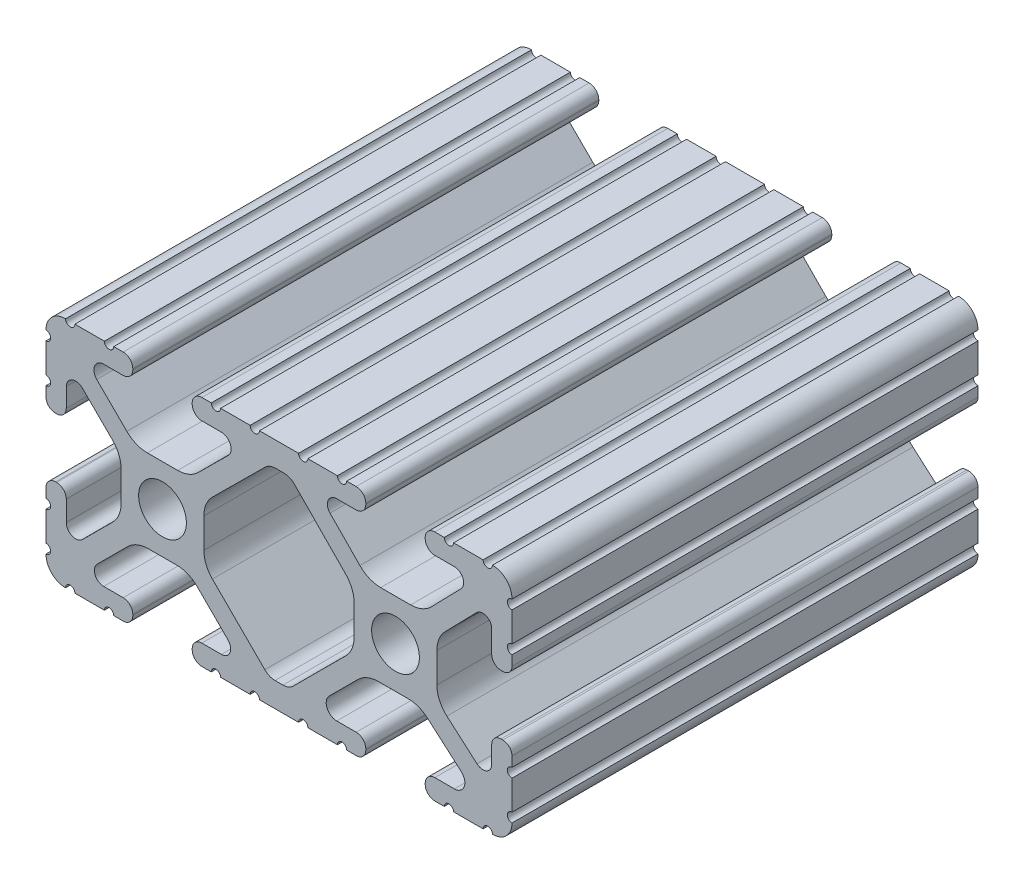
from build123d import *

# Parameters (mm, degrees)
SKETCH1_R      = 2.6035
EXTRUDE1_DEPTH = 50.8


with BuildPart() as part:
    # Sketch1 → Extrude1 (new body)
    with BuildSketch(Plane.XY):
        with BuildLine():
            Line((22.2504, 12.7), (19.03310265, 12.7))
            ThreePointArc((19.03310265, 12.7), (18.52510265, 12.192), (18.01710265, 12.7))
            Line((18.01710265, 12.7), (16.98745015, 12.7))
            ThreePointArc((16.98745015, 12.7), (16.245730386, 12.392769614), (15.9385, 11.65104985))
            Line((15.9385, 11.65104985), (15.9385, 11.53922))
            ThreePointArc((15.9385, 11.53922), (16.245750844, 10.797450844), (16.98752, 10.4902))
            Line((16.98752, 10.4902), (19.116384363, 10.4902))
            ThreePointArc((19.116384363, 10.4902), (20.052502933, 9.869096983), (19.844087081, 8.765172272))
            Line((19.844087081, 8.765172272), (16.618993479, 5.455112286))
            ThreePointArc((16.618993479, 5.455112286), (15.578994274, 4.745442459), (14.344932584, 4.4958))
            Line((14.344932584, 4.4958), (11.083317835, 4.4958))
            ThreePointArc((11.083317835, 4.4958), (9.854330953, 4.743306833), (8.816955189, 5.447238587))
            Line((8.816955189, 5.447238587), (5.564154119, 8.762652677))
            ThreePointArc((5.564154119, 8.762652677), (5.352591412, 9.867473037), (6.289393385, 10.4902))
            Line((6.289393385, 10.4902), (8.41248, 10.4902))
            ThreePointArc((8.41248, 10.4902), (9.154249156, 10.797450844), (9.4615, 11.53922))
            Line((9.4615, 11.53922), (9.4615, 11.65104985))
            ThreePointArc((9.4615, 11.65104985), (9.154269614, 12.392769614), (8.41254985, 12.7))
            Line((8.41254985, 12.7), (7.38288465, 12.7))
            ThreePointArc((7.38288465, 12.7), (6.87488465, 12.192), (6.36688465, 12.7))
            Line((6.36688465, 12.7), (3.14958095, 12.7))
            ThreePointArc((3.14958095, 12.7), (2.64158095, 12.192), (2.13358095, 12.7))
            Line((2.13358095, 12.7), (-2.13358095, 12.7))
            ThreePointArc((-2.13358095, 12.7), (-2.64158095, 12.192), (-3.14958095, 12.7))
            Line((-3.14958095, 12.7), (-6.36689735, 12.7))
            ThreePointArc((-6.36689735, 12.7), (-6.87489735, 12.192), (-7.38289735, 12.7))
            Line((-7.38289735, 12.7), (-8.41254985, 12.7))
            ThreePointArc((-8.41254985, 12.7), (-9.154269614, 12.392769614), (-9.4615, 11.65104985))
            Line((-9.4615, 11.65104985), (-9.4615, 11.53922))
            ThreePointArc((-9.4615, 11.53922), (-9.154249156, 10.797450844), (-8.41248, 10.4902))
            Line((-8.41248, 10.4902), (-6.283641037, 10.4902))
            ThreePointArc((-6.283641037, 10.4902), (-5.297291557, 9.829633109), (-5.532576693, 8.666071843))
            Line((-5.532576693, 8.666071843), (-8.809985098, 5.416263103))
            ThreePointArc((-8.809985098, 5.416263103), (-9.836720513, 4.734920264), (-11.045536121, 4.4958))
            Line((-11.045536121, 4.4958), (-14.354463879, 4.4958))
            ThreePointArc((-14.354463879, 4.4958), (-15.563279487, 4.734920264), (-16.590014902, 5.416263103))
            Line((-16.590014902, 5.416263103), (-19.867423307, 8.666071843))
            ThreePointArc((-19.867423307, 8.666071843), (-20.102708443, 9.829633109), (-19.116358963, 10.4902))
            Line((-19.116358963, 10.4902), (-16.98752, 10.4902))
            ThreePointArc((-16.98752, 10.4902), (-16.245750844, 10.797450844), (-15.9385, 11.53922))
            Line((-15.9385, 11.53922), (-15.9385, 11.65104985))
            ThreePointArc((-15.9385, 11.65104985), (-16.245730386, 12.392769614), (-16.98745015, 12.7))
            Line((-16.98745015, 12.7), (-18.01711535, 12.7))
            ThreePointArc((-18.01711535, 12.7), (-18.52511535, 12.192), (-19.03311535, 12.7))
            Line((-19.03311535, 12.7), (-22.2504, 12.7))
            ThreePointArc((-22.2504, 12.7), (-22.758323491, 12.192000006), (-23.266399977, 12.699846982))
            ThreePointArc((-23.266399977, 12.699846982), (-24.782522516, 12.082522516), (-25.399846982, 10.566399977))
            ThreePointArc((-25.399846982, 10.566399977), (-24.892000006, 10.058323491), (-25.4, 9.5504))
            Line((-25.4, 9.5504), (-25.4, 6.3330836))
            ThreePointArc((-25.4, 6.3330836), (-24.892, 5.8250836), (-25.4, 5.3170836))
            Line((-25.4, 5.3170836), (-25.4, 4.237520184))
            ThreePointArc((-25.4, 4.237520184), (-25.107393763, 3.531106237), (-24.400979816, 3.2385))
            Line((-24.400979816, 3.2385), (-24.23922, 3.2385))
            ThreePointArc((-24.23922, 3.2385), (-23.497450844, 3.545750844), (-23.1902, 4.28752))
            Line((-23.1902, 4.28752), (-23.1902, 6.334741132))
            ThreePointArc((-23.1902, 6.334741132), (-22.556026952, 7.286023527), (-21.434002553, 7.066535717))
            Line((-21.434002553, 7.066535717), (-18.147950853, 3.808156468))
            ThreePointArc((-18.147950853, 3.808156468), (-17.452759693, 2.774838327), (-17.208501877, 1.553619571))
            Line((-17.208501877, 1.553619571), (-17.208501877, -1.695179196))
            ThreePointArc((-17.208501877, -1.695179196), (-17.450738657, -2.911536421), (-18.140486065, -3.942289578))
            Line((-18.140486065, -3.942289578), (-21.431579576, -7.227386226))
            ThreePointArc((-21.431579576, -7.227386226), (-22.55444896, -7.449940594), (-23.1902, -6.498002195))
            Line((-23.1902, -6.498002195), (-23.1902, -4.28752))
            ThreePointArc((-23.1902, -4.28752), (-23.497450844, -3.545750844), (-24.23922, -3.2385))
            Line((-24.23922, -3.2385), (-24.35098, -3.2385))
            ThreePointArc((-24.35098, -3.2385), (-25.092749156, -3.545750844), (-25.4, -4.28752))
            Line((-25.4, -4.28752), (-25.4, -5.3171344))
            ThreePointArc((-25.4, -5.3171344), (-24.892, -5.8251344), (-25.4, -6.3331344))
            Line((-25.4, -6.3331344), (-25.4, -9.5504))
            ThreePointArc((-25.4, -9.5504), (-24.892000006, -10.058323491), (-25.399846982, -10.566399977))
            ThreePointArc((-25.399846982, -10.566399977), (-24.782522516, -12.082522516), (-23.266399977, -12.699846982))
            ThreePointArc((-23.266399977, -12.699846982), (-22.758323491, -12.192000006), (-22.2504, -12.7))
            Line((-22.2504, -12.7), (-19.03308995, -12.7))
            ThreePointArc((-19.03308995, -12.7), (-18.52508995, -12.192), (-18.01708995, -12.7))
            Line((-18.01708995, -12.7), (-16.9874692, -12.7))
            ThreePointArc((-16.9874692, -12.7), (-16.245700044, -12.392749156), (-15.9384492, -11.65098))
            Line((-15.9384492, -11.65098), (-15.9384492, -11.53922))
            ThreePointArc((-15.9384492, -11.53922), (-16.245700044, -10.797450844), (-16.9874692, -10.4902))
            Line((-16.9874692, -10.4902), (-19.116358963, -10.4902))
            ThreePointArc((-19.116358963, -10.4902), (-20.055197748, -9.862578342), (-19.834124023, -8.755124678))
            Line((-19.834124023, -8.755124678), (-16.49660751, -5.423689618))
            ThreePointArc((-16.49660751, -5.423689618), (-15.467274017, -4.736928798), (-14.253591699, -4.4958))
            Line((-14.253591699, -4.4958), (-11.146408301, -4.4958))
            ThreePointArc((-11.146408301, -4.4958), (-9.932725983, -4.736928798), (-8.90339249, -5.423689618))
            Line((-8.90339249, -5.423689618), (-5.565875977, -8.755124678))
            ThreePointArc((-5.565875977, -8.755124678), (-5.344802252, -9.862578342), (-6.283641037, -10.4902))
            Line((-6.283641037, -10.4902), (-8.4125308, -10.4902))
            ThreePointArc((-8.4125308, -10.4902), (-9.154299956, -10.797450844), (-9.4615508, -11.53922))
            Line((-9.4615508, -11.53922), (-9.4615508, -11.65098))
            ThreePointArc((-9.4615508, -11.65098), (-9.154299956, -12.392749156), (-8.4125308, -12.7))
            Line((-8.4125308, -12.7), (-7.38287195, -12.7))
            ThreePointArc((-7.38287195, -12.7), (-6.87487195, -12.192), (-6.36687195, -12.7))
            Line((-6.36687195, -12.7), (-3.14960635, -12.7))
            ThreePointArc((-3.14960635, -12.7), (-2.64160635, -12.192), (-2.13360635, -12.7))
            Line((-2.13360635, -12.7), (2.13360635, -12.7))
            ThreePointArc((2.13360635, -12.7), (2.64159365, -12.1920127), (3.14958095, -12.7))
            Line((3.14958095, -12.7), (6.36691005, -12.7))
            ThreePointArc((6.36691005, -12.7), (6.87491005, -12.192), (7.38291005, -12.7))
            Line((7.38291005, -12.7), (8.4125308, -12.7))
            ThreePointArc((8.4125308, -12.7), (9.154299956, -12.392749156), (9.4615508, -11.65098))
            Line((9.4615508, -11.65098), (9.4615508, -11.53922))
            ThreePointArc((9.4615508, -11.53922), (9.154299956, -10.797450844), (8.4125308, -10.4902))
            Line((8.4125308, -10.4902), (6.289393385, -10.4902))
            ThreePointArc((6.289393385, -10.4902), (5.231590322, -9.783049717), (5.480677245, -8.535265862))
            Line((5.480677245, -8.535265862), (8.597933595, -5.423689618))
            ThreePointArc((8.597933595, -5.423689618), (9.627267088, -4.736928798), (10.840949406, -4.4958))
            Line((10.840949406, -4.4958), (14.102564155, -4.4958))
            ThreePointArc((14.102564155, -4.4958), (15.215927525, -4.697410182), (16.187895372, -5.276636531))
            Line((16.187895372, -5.276636531), (19.868247549, -8.482246082))
            ThreePointArc((19.868247549, -8.482246082), (20.188435806, -9.746879864), (19.116384363, -10.4902))
            Line((19.116384363, -10.4902), (16.9874692, -10.4902))
            ThreePointArc((16.9874692, -10.4902), (16.245700044, -10.797450844), (15.9384492, -11.53922))
            Line((15.9384492, -11.53922), (15.9384492, -11.65098))
            ThreePointArc((15.9384492, -11.65098), (16.245700044, -12.392749156), (16.9874692, -12.7))
            Line((16.9874692, -12.7), (18.01710265, -12.7))
            ThreePointArc((18.01710265, -12.7), (18.52510265, -12.192), (19.03310265, -12.7))
            Line((19.03310265, -12.7), (22.2504, -12.7))
            ThreePointArc((22.2504, -12.7), (22.758323491, -12.192000006), (23.266399977, -12.699846982))
            ThreePointArc((23.266399977, -12.699846982), (24.782522516, -12.082522516), (25.399846982, -10.566399977))
            ThreePointArc((25.399846982, -10.566399977), (24.892000006, -10.058323492), (25.4, -9.550400001))
            Line((25.4, -9.550400001), (25.4, -6.333083592))
            ThreePointArc((25.4, -6.333083592), (24.892000001, -5.825083593), (25.4, -5.317083593))
            Line((25.4, -5.317083593), (25.4, -4.237520184))
            ThreePointArc((25.4, -4.237520184), (25.107393763, -3.531106237), (24.400979816, -3.2385))
            Line((24.400979816, -3.2385), (24.189220184, -3.2385))
            ThreePointArc((24.189220184, -3.2385), (23.482806237, -3.531106237), (23.1902, -4.237520184))
            Line((23.1902, -4.237520184), (23.1902, -6.155876159))
            ThreePointArc((23.1902, -6.155876159), (22.62232736, -7.038258539), (21.583974541, -6.886926384))
            Line((21.583974541, -6.886926384), (18.29817066, -4.024970844))
            ThreePointArc((18.29817066, -4.024970844), (17.493730985, -2.946044689), (17.208501877, -1.630807374))
            Line((17.208501877, -1.630807374), (17.208501877, 1.630807374))
            ThreePointArc((17.208501877, 1.630807374), (17.442348332, 2.82673414), (18.109440981, 3.846495088))
            Line((18.109440981, 3.846495088), (21.526346532, 7.353420386))
            ThreePointArc((21.526346532, 7.353420386), (22.585896263, 7.574939077), (23.1902, 6.676867167))
            Line((23.1902, 6.676867167), (23.1902, 4.237520184))
            ThreePointArc((23.1902, 4.237520184), (23.482806237, 3.531106237), (24.189220184, 3.2385))
            Line((24.189220184, 3.2385), (24.400979816, 3.2385))
            ThreePointArc((24.400979816, 3.2385), (25.107393763, 3.531106237), (25.4, 4.237520184))
            Line((25.4, 4.237520184), (25.4, 5.3170836))
            ThreePointArc((25.4, 5.3170836), (24.891949193, 5.825134407), (25.4, 6.333185215))
            Line((25.4, 6.333185215), (25.4, 9.550400015))
            ThreePointArc((25.4, 9.550400015), (24.892000013, 10.058323498), (25.399846982, 10.566399977))
            ThreePointArc((25.399846982, 10.566399977), (24.782522516, 12.082522516), (23.266399977, 12.699846982))
            ThreePointArc((23.266399977, 12.699846982), (22.758323491, 12.192000006), (22.2504, 12.7))
        make_face()
        with Locations((-12.7, 0)):
            Circle(SKETCH1_R, mode=Mode.SUBTRACT)
        with Locations((12.7, 0)):
            Circle(SKETCH1_R, mode=Mode.SUBTRACT)
        with BuildLine():
            Line((-7.259513935, -3.869413038), (-1.545748891, -9.572766749))
            ThreePointArc((-1.545748891, -9.572766749), (-1.035199478, -9.913400116), (-0.433213048, -10.033))
            Line((-0.433213048, -10.033), (0.433213048, -10.033))
            ThreePointArc((0.433213048, -10.033), (1.035199478, -9.913400116), (1.545748891, -9.572766749))
            Line((1.545748891, -9.572766749), (7.259513935, -3.869413038))
            ThreePointArc((7.259513935, -3.869413038), (7.949261343, -2.838659881), (8.191498123, -1.622302656))
            Line((8.191498123, -1.622302656), (8.191498123, 1.622302656))
            ThreePointArc((8.191498123, 1.622302656), (7.955573352, 2.823327967), (7.282860769, 3.845864069))
            Line((7.282860769, 3.845864069), (1.675572808, 9.561086461))
            ThreePointArc((1.675572808, 9.561086461), (1.161034429, 9.910236611), (0.551456936, 10.033))
            Line((0.551456936, 10.033), (-0.395199982, 10.033))
            ThreePointArc((-0.395199982, 10.033), (-0.994772524, 9.914396349), (-1.50403329, 9.576450301))
            Line((-1.50403329, 9.576450301), (-7.252049147, 3.876839553))
            ThreePointArc((-7.252049147, 3.876839553), (-7.947240307, 2.843521412), (-8.191498123, 1.622302656))
            Line((-8.191498123, 1.622302656), (-8.191498123, -1.622302656))
            ThreePointArc((-8.191498123, -1.622302656), (-7.949261343, -2.838659881), (-7.259513935, -3.869413038))
        make_face(mode=Mode.SUBTRACT)
    extrude(amount=-EXTRUDE1_DEPTH)


solid = part.part
